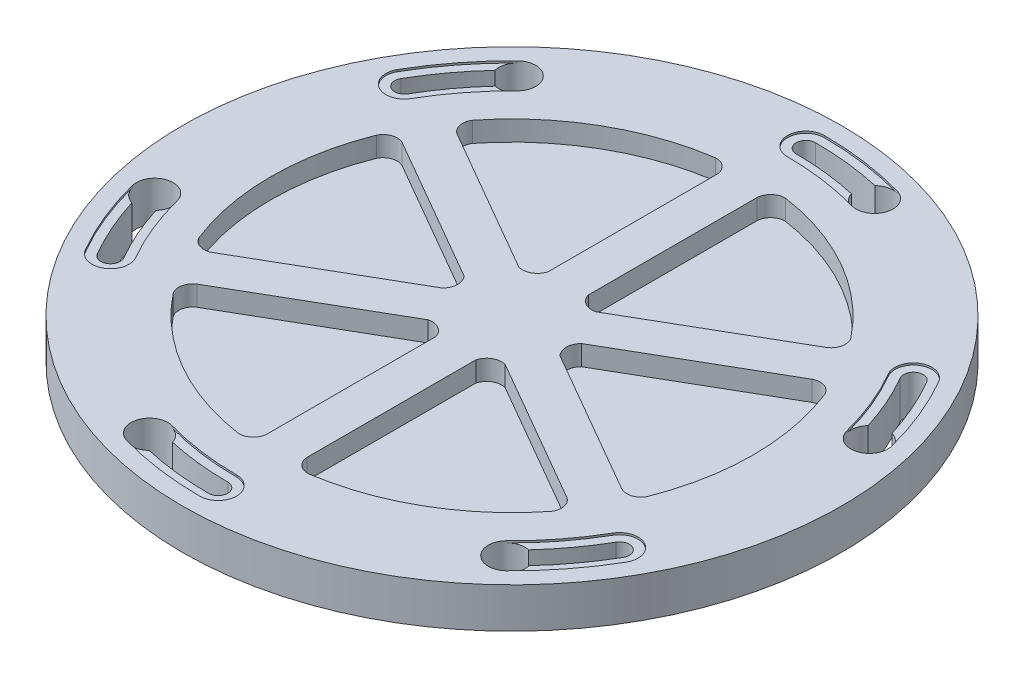
from build123d import *

# Parameters (mm, degrees)
SKETCH1_R           = 82
BOSS_EXTRUDE1_DEPTH = 10
BOSS_EXTRUDE3_DEPTH = 9.525
CIRPATTERN1_COUNT   = 6
CUT_EXTRUDE1_DEPTH  = 5


with BuildPart() as part:
    # Sketch1 → Boss-Extrude1 (new body)
    with BuildSketch(Plane(origin=(0, 0, 0), x_dir=(1, 0, 0), z_dir=(0, 1, 0))):
        Circle(SKETCH1_R)
        with BuildLine():
            ThreePointArc((0, -68.539794907), (4.585205093, -73.125), (0, -77.710205093))
            ThreePointArc((0, -77.710205093), (-10.627709007, -76.980047914), (-21.05570427, -74.803297343))
            ThreePointArc((-21.05570427, -74.803297343), (-24.227021824, -69.147242492), (-18.570966974, -65.975924939))
            ThreePointArc((-18.570966974, -65.975924939), (-9.373556469, -67.895801969), (0, -68.539794907))
        make_face(mode=Mode.SUBTRACT)
        with BuildLine():
            ThreePointArc((-59.357203559, -34.269897453), (-61.035505105, -40.533404092), (-67.299011744, -38.855102547))
            ThreePointArc((-67.299011744, -38.855102547), (-71.980531582, -29.286157973), (-75.309407921, -19.166873879))
            ThreePointArc((-75.309407921, -19.166873879), (-71.996779512, -13.592404889), (-66.422310522, -16.905033297))
            ThreePointArc((-66.422310522, -16.905033297), (-63.48626755, -25.830162958), (-59.357203559, -34.269897453))
        make_face(mode=Mode.SUBTRACT)
        with BuildLine():
            ThreePointArc((59.357203559, -34.269897453), (65.620710198, -32.591595908), (67.299011744, -38.855102547))
            ThreePointArc((67.299011744, -38.855102547), (61.352822575, -47.693889942), (54.25370365, -55.636423464))
            ThreePointArc((54.25370365, -55.636423464), (47.769757688, -55.554837604), (47.851343548, -49.070891641))
            ThreePointArc((47.851343548, -49.070891641), (54.112711081, -42.065639011), (59.357203559, -34.269897453))
        make_face(mode=Mode.SUBTRACT)
        with BuildLine():
            ThreePointArc((-59.357203559, 34.269897453), (-65.620710198, 32.591595908), (-67.299011744, 38.855102547))
            ThreePointArc((-67.299011744, 38.855102547), (-61.352822575, 47.693889942), (-54.25370365, 55.636423464))
            ThreePointArc((-54.25370365, 55.636423464), (-47.769757688, 55.554837604), (-47.851343548, 49.070891641))
            ThreePointArc((-47.851343548, 49.070891641), (-54.112711081, 42.065639011), (-59.357203559, 34.269897453))
        make_face(mode=Mode.SUBTRACT)
        with BuildLine():
            ThreePointArc((59.357203559, 34.269897453), (61.035505105, 40.533404092), (67.299011744, 38.855102547))
            ThreePointArc((67.299011744, 38.855102547), (71.980531582, 29.286157973), (75.309407921, 19.166873879))
            ThreePointArc((75.309407921, 19.166873879), (71.996779512, 13.592404889), (66.422310522, 16.905033297))
            ThreePointArc((66.422310522, 16.905033297), (63.48626755, 25.830162958), (59.357203559, 34.269897453))
        make_face(mode=Mode.SUBTRACT)
        with BuildLine():
            ThreePointArc((0, 68.539794907), (-4.585205093, 73.125), (0, 77.710205093))
            ThreePointArc((0, 77.710205093), (10.627709007, 76.980047914), (21.05570427, 74.803297343))
            ThreePointArc((21.05570427, 74.803297343), (24.227021824, 69.147242492), (18.570966974, 65.975924939))
            ThreePointArc((18.570966974, 65.975924939), (9.373556469, 67.895801969), (0, 68.539794907))
        make_face(mode=Mode.SUBTRACT)
    extrude(amount=BOSS_EXTRUDE1_DEPTH)

    # Sketch1<4> → Boss-Extrude3 (add)
    with BuildSketch(Plane(origin=(0, 0, 0), x_dir=(1, 0, 0), z_dir=(0, 1, 0))):
        with BuildLine():
            ThreePointArc((-75.309407921, -19.166873879), (-71.980531582, -29.286157973), (-67.299011744, -38.855102547))
            ThreePointArc((-67.299011744, -38.855102547), (-61.035505105, -40.533404092), (-59.357203559, -34.269897453))
            ThreePointArc((-59.357203559, -34.269897453), (-63.48626755, -25.830162958), (-66.422310522, -16.905033297))
            ThreePointArc((-66.422310522, -16.905033297), (-66.418285743, -19.150940539), (-67.48132535, -21.129339471))
            ThreePointArc((-67.48132535, -21.129339471), (-64.751733563, -28.414631056), (-61.238335159, -35.355969289))
            ThreePointArc((-61.238335159, -35.355969289), (-62.121576941, -38.652272492), (-65.417880144, -37.769030711))
            ThreePointArc((-65.417880144, -37.769030711), (-69.197773577, -30.293016611), (-72.126599919, -22.444427093))
            ThreePointArc((-72.126599919, -22.444427093), (-74.155284422, -21.230290389), (-75.309407921, -19.166873879))
        make_face()
    boss_extrude3 = extrude(amount=BOSS_EXTRUDE3_DEPTH)

    # CirPattern1: Boss-Extrude3 ×6 about axis
    cirpattern1_axis = Axis((0, 10, 0), (0, 1, 0))
    for i in range(1, CIRPATTERN1_COUNT):
        add(boss_extrude3.rotate(cirpattern1_axis, i * 360 / CIRPATTERN1_COUNT))

    # Sketch2 → Cut-Extrude1 (cut)
    with BuildSketch(Plane(origin=(0, 10, 0), x_dir=(1, 0, 0), z_dir=(0, 1, 0))):
        with BuildLine():
            Line((-14.620190528, 2.667468245), (-51.015872171, 23.680524839))
            ThreePointArc((-51.015872171, 23.680524839), (-53.723615936, 23.879831653), (-55.779211114, 22.106098875))
            ThreePointArc((-55.779211114, 22.106098875), (-60, 0), (-55.779211114, -22.106098875))
            ThreePointArc((-55.779211114, -22.106098875), (-53.723615936, -23.879831653), (-51.015872171, -23.680524839))
            Line((-51.015872171, -23.680524839), (-14.620190528, -2.667468245))
            ThreePointArc((-14.620190528, -2.667468245), (-13.515289004, 0), (-14.620190528, 2.667468245))
        make_face()
        with BuildLine():
            Line((-5, 13.995190528), (-5, 56.021303716))
            ThreePointArc((-5, 56.021303716), (-6.181267118, 58.46593201), (-8.745162353, 59.359263266))
            ThreePointArc((-8.745162353, 59.359263266), (-30, 51.961524227), (-47.034048761, 37.253164391))
            ThreePointArc((-47.034048761, 37.253164391), (-47.542348818, 34.586100357), (-46.015872171, 32.340778877))
            Line((-46.015872171, 32.340778877), (-9.620190528, 11.327722283))
            ThreePointArc((-9.620190528, 11.327722283), (-6.757644502, 11.704583617), (-5, 13.995190528))
        make_face()
        with BuildLine():
            Line((-9.620190528, -11.327722283), (-46.015872171, -32.340778877))
            ThreePointArc((-46.015872171, -32.340778877), (-47.542348818, -34.586100357), (-47.034048761, -37.253164391))
            ThreePointArc((-47.034048761, -37.253164391), (-30, -51.961524227), (-8.745162353, -59.359263266))
            ThreePointArc((-8.745162353, -59.359263266), (-6.181267118, -58.46593201), (-5, -56.021303716))
            Line((-5, -56.021303716), (-5, -13.995190528))
            ThreePointArc((-5, -13.995190528), (-6.757644502, -11.704583617), (-9.620190528, -11.327722283))
        make_face()
        with BuildLine():
            Line((9.620190528, 11.327722283), (46.015872171, 32.340778877))
            ThreePointArc((46.015872171, 32.340778877), (47.542348818, 34.586100357), (47.034048761, 37.253164391))
            ThreePointArc((47.034048761, 37.253164391), (30, 51.961524227), (8.745162353, 59.359263266))
            ThreePointArc((8.745162353, 59.359263266), (6.181267118, 58.46593201), (5, 56.021303716))
            Line((5, 56.021303716), (5, 13.995190528))
            ThreePointArc((5, 13.995190528), (6.757644502, 11.704583617), (9.620190528, 11.327722283))
        make_face()
        with BuildLine():
            Line((14.620190528, -2.667468245), (51.015872171, -23.680524839))
            ThreePointArc((51.015872171, -23.680524839), (53.723615936, -23.879831653), (55.779211114, -22.106098875))
            ThreePointArc((55.779211114, -22.106098875), (60, 0), (55.779211114, 22.106098875))
            ThreePointArc((55.779211114, 22.106098875), (53.723615936, 23.879831653), (51.015872171, 23.680524839))
            Line((51.015872171, 23.680524839), (14.620190528, 2.667468245))
            ThreePointArc((14.620190528, 2.667468245), (13.515289004, 0), (14.620190528, -2.667468245))
        make_face()
        with BuildLine():
            Line((5, -13.995190528), (5, -56.021303716))
            ThreePointArc((5, -56.021303716), (6.181267118, -58.46593201), (8.745162353, -59.359263266))
            ThreePointArc((8.745162353, -59.359263266), (30, -51.961524227), (47.034048761, -37.253164391))
            ThreePointArc((47.034048761, -37.253164391), (47.542348818, -34.586100357), (46.015872171, -32.340778877))
            Line((46.015872171, -32.340778877), (9.620190528, -11.327722283))
            ThreePointArc((9.620190528, -11.327722283), (6.757644502, -11.704583617), (5, -13.995190528))
        make_face()
    extrude(amount=-CUT_EXTRUDE1_DEPTH, mode=Mode.SUBTRACT)


solid = part.part
